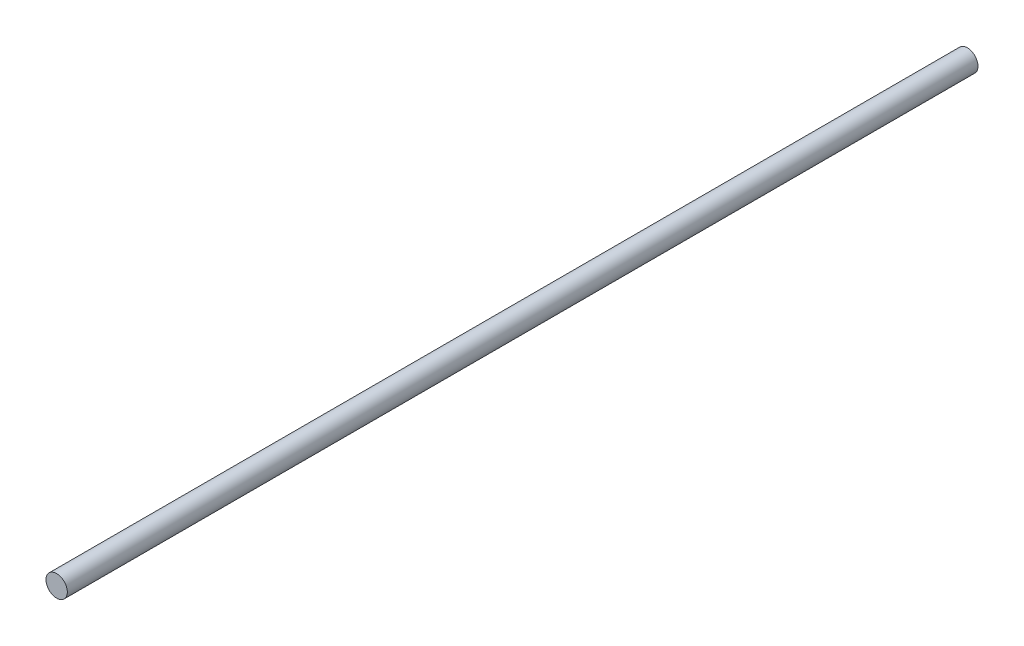
from build123d import *

# Parameters (mm, degrees)
SKETCH1_R           = 3
BOSS_EXTRUDE1_DEPTH = 256


with BuildPart() as part:
    # Sketch1 → Boss-Extrude1 (new body)
    with BuildSketch(Plane.XY):
        Circle(SKETCH1_R)
    extrude(amount=BOSS_EXTRUDE1_DEPTH)


solid = part.part
